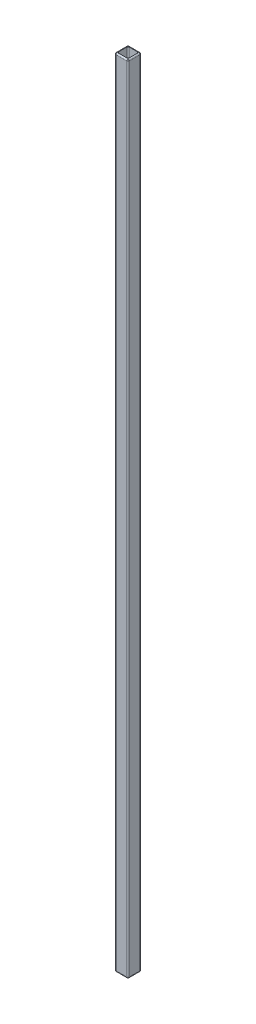
from build123d import *

# Parameters (mm, degrees)
SKETCH4_W           = 25.4
SKETCH4_H           = 25.4
BOSS_EXTRUDE6_DEPTH = 1524
SHELL1_T            = -2.54
FILLET1_R           = 2.54
FILLET2_R           = 2.54
FILLET3_R           = 2.54
FILLET5_R           = 2.54
FILLET6_R           = 2.54


with BuildPart() as part:
    # Sketch4 → Boss-Extrude6 (new body)
    with BuildSketch(Plane(origin=(0, 0, 0), x_dir=(1, 0, 0), z_dir=(0, 1, 0))):
        Rectangle(SKETCH4_W, SKETCH4_H)
    extrude(amount=BOSS_EXTRUDE6_DEPTH)

    # Shell1
    shell1_openings = [part.faces().sort_by_distance(p)[0] for p in [
        (0, 1524, 0),
        (0, 0, 0),
    ]]
    offset(amount=SHELL1_T, openings=shell1_openings, kind=Kind.INTERSECTION)

    # Fillet1
    fillet1_edges = [part.edges().sort_by_distance(p)[0] for p in [
        (12.7, 762, -12.7),
        (12.7, 762, 12.7),
        (-12.7, 762, 12.7),
        (-12.7, 762, -12.7),
    ]]
    fillet(fillet1_edges, radius=FILLET1_R)

    # Fillet2
    fillet2_edges = [part.edges().sort_by_distance(p)[0] for p in [
        (-10.16, 762, -10.16),
    ]]
    fillet(fillet2_edges, radius=FILLET2_R)

    # Fillet3
    fillet3_edges = [part.edges().sort_by_distance(p)[0] for p in [
        (10.16, 762, -10.16),
        (-10.16, 762, 10.16),
        (10.16, 762, 10.16),
    ]]
    fillet(fillet3_edges, radius=FILLET3_R)

    # Fillet5
    fillet5_edges = [part.edges().sort_by_distance(p)[0] for p in [
        (0, 1524, 12.7),
        (-12.7, 1524, 0),
        (0, 1524, -12.7),
        (12.7, 1524, 0),
        (-11.956051224, 1524, -11.956051224),
        (11.956051224, 1524, -11.956051224),
        (11.956051224, 1524, 11.956051224),
        (-11.956051224, 1524, 11.956051224),
    ]]
    fillet(fillet5_edges, radius=FILLET5_R - 0.0001)  # a hair under: the kernel refuses the full size

    # Fillet6
    fillet6_edges = [part.edges().sort_by_distance(p)[0] for p in [
        (0, 0, 12.7),
        (0, 0, -12.7),
        (12.7, 0, 0),
        (-12.7, 0, 0),
        (-11.956051224, 0, -11.956051224),
        (11.956051224, 0, -11.956051224),
        (11.956051224, 0, 11.956051224),
        (-11.956051224, 0, 11.956051224),
    ]]
    fillet(fillet6_edges, radius=FILLET6_R - 0.0001)  # a hair under: the kernel refuses the full size


solid = part.part
